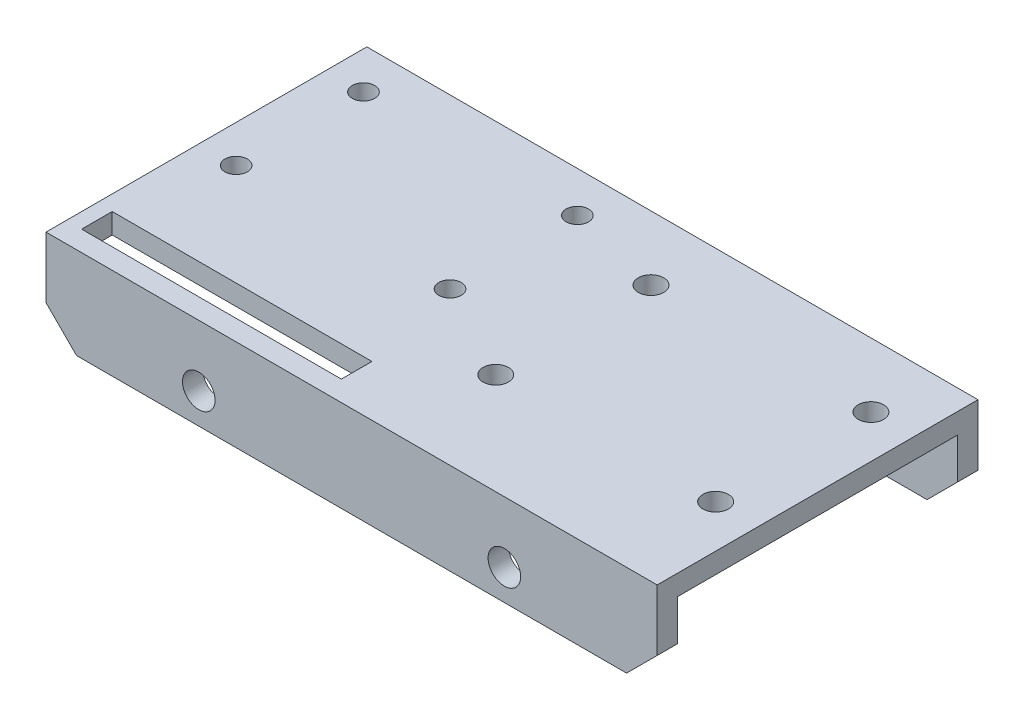
from build123d import *

# Parameters (mm, degrees)
SKETCH1_W               = 60
SKETCH1_H               = 31.5
BOSS_EXTRUDE1_DEPTH     = 2
SKETCH2_W               = 60
SKETCH2_H               = 2
BOSS_EXTRUDE2_DEPTH     = 7
CUT_EXTRUDE1_DEPTH      = 45.0596187
CUT_EXTRUDE1_DEPTH_BACK = 45.0596187
SKETCH3_R               = 1.6
CHAMFER1_SIZE           = 3
CHAMFER3_SIZE           = 3
SKETCH4_R               = 1.25
SKETCH4_R_2             = 1.1
CUT_EXTRUDE2_DEPTH      = 10
SKETCH5_W               = 25.5
SKETCH5_H               = 3
CUT_EXTRUDE3_DEPTH      = 10


with BuildPart() as part:
    # Sketch1 → Boss-Extrude1 (new body)
    with BuildSketch(Plane(origin=(0, 0, 0), x_dir=(1, 0, 0), z_dir=(0, 1, 0))):
        Rectangle(SKETCH1_W, SKETCH1_H)
    extrude(amount=BOSS_EXTRUDE1_DEPTH)

    # Sketch2 → Boss-Extrude2 (add)
    with BuildSketch(Plane.XZ):
        with Locations((0, -14.75)):
            Rectangle(SKETCH2_W, SKETCH2_H)
        with Locations((0, 14.75)):
            Rectangle(SKETCH2_W, SKETCH2_H)
    extrude(amount=BOSS_EXTRUDE2_DEPTH)

    # Sketch3 → Cut-Extrude1 (cut, two sides: drawn at the far end of the back side and taken through both)
    with BuildSketch(Plane(origin=(0, 0, -15.75), x_dir=(-1, 0, 0), z_dir=(0, 0, -1)).offset(-CUT_EXTRUDE1_DEPTH_BACK)):
        with Locations((15, -4)):
            Circle(SKETCH3_R)
        with Locations((-15, -4)):
            Circle(SKETCH3_R)
    extrude(amount=CUT_EXTRUDE1_DEPTH + CUT_EXTRUDE1_DEPTH_BACK, mode=Mode.SUBTRACT)

    # Chamfer1
    chamfer1_edges = [part.edges().sort_by_distance(p)[0] for p in [
        (-30, -7, -14.75),
        (30, -7, -14.75),
    ]]
    chamfer(chamfer1_edges, length=CHAMFER1_SIZE)

    # Chamfer3
    chamfer3_edges = [part.edges().sort_by_distance(p)[0] for p in [
        (30, -7, 14.75),
        (-30, -7, 14.75),
    ]]
    chamfer(chamfer3_edges, length=CHAMFER3_SIZE)

    # Sketch4 → Cut-Extrude2 (cut)
    with BuildSketch(Plane(origin=(0, 2, 0), x_dir=(1, 0, 0), z_dir=(0, 1, 0))):
        with Locations((25.795, -5.801)):
            Circle(SKETCH4_R)
        with Locations((4.205, -5.801)):
            Circle(SKETCH4_R)
        with Locations((25.795, 9.439)):
            Circle(SKETCH4_R)
        with Locations((4.205, 9.439)):
            Circle(SKETCH4_R)
        with Locations((-26.335, -0.75)):
            Circle(SKETCH4_R_2)
        with Locations((-26.335, 11.75)):
            Circle(SKETCH4_R_2)
        with Locations((-5.335, -0.75)):
            Circle(SKETCH4_R_2)
        with Locations((-5.335, 11.75)):
            Circle(SKETCH4_R_2)
    extrude(amount=-CUT_EXTRUDE2_DEPTH, mode=Mode.SUBTRACT)

    # Sketch5 → Cut-Extrude3 (cut)
    with BuildSketch(Plane.XZ):
        with Locations((-15.75, 12.25)):
            Rectangle(SKETCH5_W, SKETCH5_H)
    extrude(amount=-CUT_EXTRUDE3_DEPTH, mode=Mode.SUBTRACT)


solid = part.part
